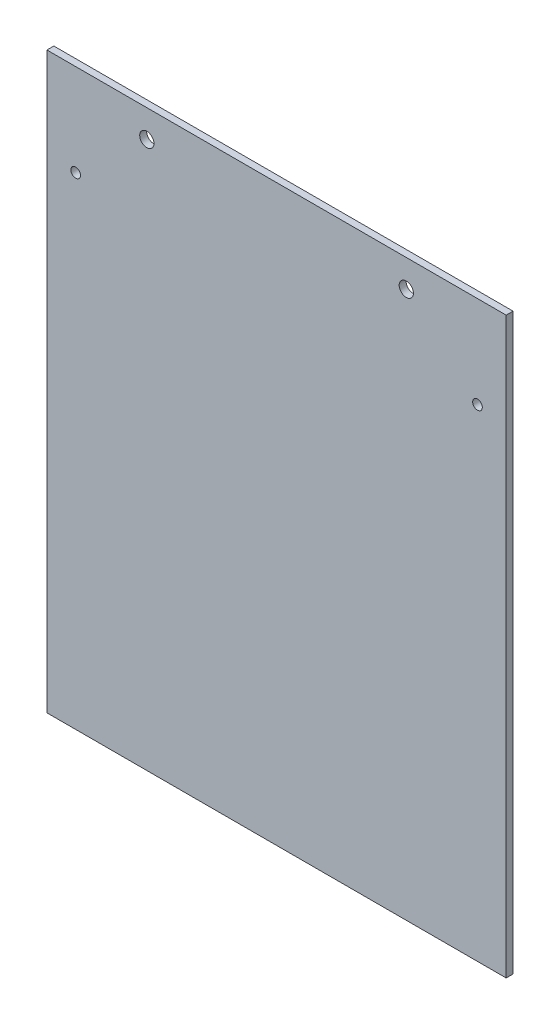
from build123d import *

# Parameters (mm, degrees)
SZKIC1_W                    = 200
SZKIC1_H                    = 250
DODANIE_WYCI_GNI_CIE1_DEPTH = 3
SZKIC2_R                    = 2.1
SZKIC2_R_2                  = 3.1
WYTNIJ_WYCI_GNI_CIE1_DEPTH  = 321.170267202


with BuildPart() as part:
    # Szkic1 → Dodanie-wyciągnięcie1 (new body)
    with BuildSketch(Plane.XY):
        with Locations((100, 125)):
            Rectangle(SZKIC1_W, SZKIC1_H)
    extrude(amount=DODANIE_WYCI_GNI_CIE1_DEPTH)

    # Szkic2 → Wytnij-wyciągnięcie1 (cut, through all)
    with BuildSketch(Plane.XY.offset(3)):
        with Locations((12.5, 210)):
            Circle(SZKIC2_R)
        with Locations((43.5, 238)):
            Circle(SZKIC2_R_2)
        with Locations((156.5, 238)):
            Circle(SZKIC2_R_2)
        with Locations((187.5, 210)):
            Circle(SZKIC2_R)
    extrude(amount=-WYTNIJ_WYCI_GNI_CIE1_DEPTH, mode=Mode.SUBTRACT)


solid = part.part
